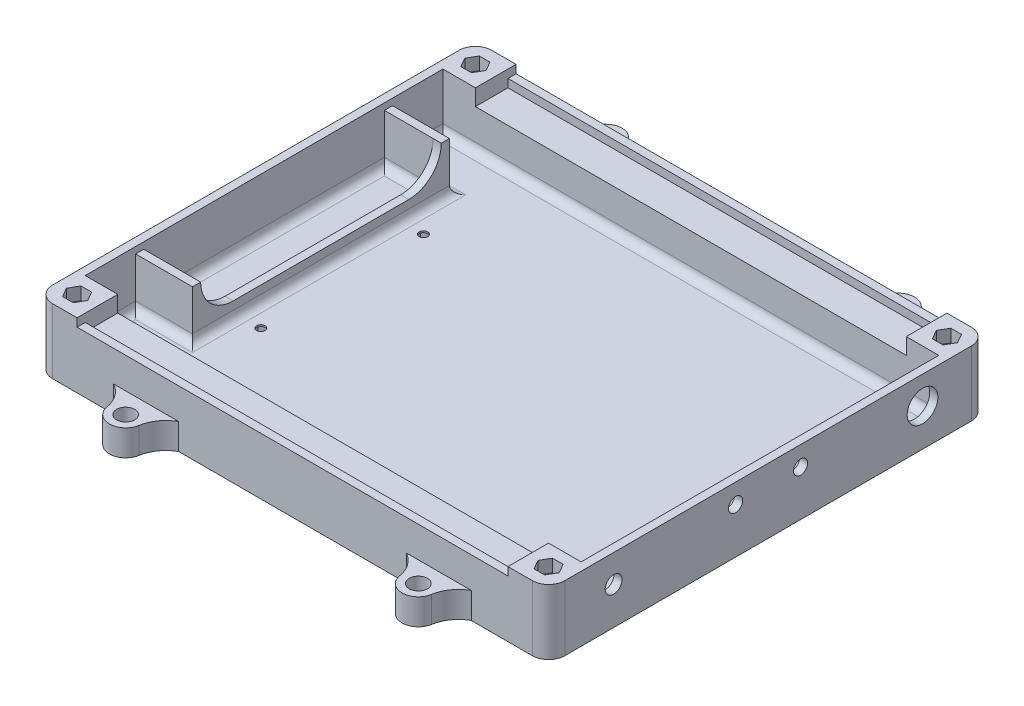
from build123d import *

# Parameters (mm, degrees)
SKETCH18_W              = 200.025
SKETCH18_H              = 139.7
BOSS_EXTRUDE6_DEPTH     = 25.4
SKETCH20_W              = 193.675
SKETCH20_H              = 139.7
CUT_EXTRUDE6_DEPTH      = 21.59
SKETCH22_W              = 200.025
SKETCH22_H              = 15.875
BOSS_EXTRUDE7_DEPTH     = 25.4
SKETCH23_W              = 200.025
SKETCH23_H              = 15.875
BOSS_EXTRUDE8_DEPTH     = 25.4
SKETCH24_W              = 168.275
SKETCH24_H              = 171.45
CUT_EXTRUDE7_DEPTH      = 3.175
SKETCH28_W              = 168.275
SKETCH28_H              = 12.7
CUT_EXTRUDE10_DEPTH     = 3.175
SKETCH31_R              = 1.65
SKETCH31_R_2            = 1.651
CUT_EXTRUDE15_DEPTH     = 1.825
CUT_EXTRUDE17_DEPTH     = 3.175
SKETCH39_R              = 2.2
CUT_EXTRUDE18_DEPTH     = 26.5
CUT_EXTRUDE20_DEPTH     = 5
SKETCH40_R              = 4.4
CUT_EXTRUDE19_DEPTH     = 17.225
SKETCH47_R              = 3.556
BOSS_EXTRUDE14_DEPTH    = 10.16
MIRROR6_COPY_1_SKETCH_R = 2.2
MIRROR6_COPY_1_DEPTH    = 26.5
MIRROR6_COPY_2_DEPTH    = 5
MIRROR6_COPY_3_SKETCH_R = 4.4
MIRROR6_COPY_3_DEPTH    = 17.225
CUT_EXTRUDE21_REACH     = 224.285
SKETCH48_R              = 6
SKETCH48_R_2            = 3.3
SKETCH48_R_3            = 2.75
SKETCH49_W              = 3.175
SKETCH49_H              = 93.98
BOSS_EXTRUDE15_DEPTH    = 6.35
SKETCH50_W              = 22.225
SKETCH50_H              = 3.175
BOSS_EXTRUDE16_DEPTH    = 19.05
FILLET1_R               = 6.35
FILLET2_R               = 3.175
FILLET3_R               = 12.7


with BuildPart() as part:
    # Sketch18 → Boss-Extrude6 (new body)
    with BuildSketch(Plane(origin=(0, 0, 0), x_dir=(1, 0, 0), z_dir=(0, 1, 0))):
        Rectangle(SKETCH18_W, SKETCH18_H)
    extrude(amount=BOSS_EXTRUDE6_DEPTH)

    # Sketch20 → Cut-Extrude6 (cut)
    with BuildSketch(Plane(origin=(0, 25.4, 0), x_dir=(1, 0, 0), z_dir=(0, 1, 0))):
        Rectangle(SKETCH20_W, SKETCH20_H)
    extrude(amount=-CUT_EXTRUDE6_DEPTH, mode=Mode.SUBTRACT)

    # Sketch22 → Boss-Extrude7 (add)
    with BuildSketch(Plane(origin=(0, 0, 0), x_dir=(1, 0, 0), z_dir=(0, 1, 0))):
        with Locations((0, -77.7875)):
            Rectangle(SKETCH22_W, SKETCH22_H)
    extrude(amount=BOSS_EXTRUDE7_DEPTH)

    # Sketch23 → Boss-Extrude8 (add)
    with BuildSketch(Plane(origin=(0, 0, 0), x_dir=(1, 0, 0), z_dir=(0, 1, 0))):
        with Locations((0, 77.7875)):
            Rectangle(SKETCH23_W, SKETCH23_H)
    extrude(amount=BOSS_EXTRUDE8_DEPTH)

    # Sketch24 → Cut-Extrude7 (cut)
    with BuildSketch(Plane(origin=(0, 25.4, 0), x_dir=(1, 0, 0), z_dir=(0, 1, 0))):
        Rectangle(SKETCH24_W, SKETCH24_H)
    extrude(amount=-CUT_EXTRUDE7_DEPTH, mode=Mode.SUBTRACT)

    # Sketch28 → Cut-Extrude10 (cut)
    with BuildSketch(Plane(origin=(0, 22.225, 0), x_dir=(1, 0, 0), z_dir=(0, 1, 0))):
        with Locations((0, 76.2)):
            Rectangle(SKETCH28_W, SKETCH28_H)
    cut_extrude10 = extrude(amount=-CUT_EXTRUDE10_DEPTH, mode=Mode.SUBTRACT)

    # Mirror5: Cut-Extrude10 across plane
    add(cut_extrude10.mirror(Plane.XY), mode=Mode.SUBTRACT)

    # Sketch31 → Cut-Extrude15 (cut)
    with BuildSketch(Plane(origin=(0, 3.81, 0), x_dir=(1, 0, 0), z_dir=(0, 1, 0))):
        with Locations(Location((-66.3575, 31.75, 0), (0, 0, 270))):
            Circle(SKETCH31_R)
        with Locations(Location((86.0425, 31.75, 0), (0, 0, 270))):
            Circle(SKETCH31_R_2)
        with Locations(Location((86.0425, -31.75, 0), (0, 0, 270))):
            Circle(SKETCH31_R_2)
        with Locations(Location((-66.3575, -31.75, 0), (0, 0, 270))):
            Circle(SKETCH31_R)
    extrude(amount=-CUT_EXTRUDE15_DEPTH, mode=Mode.SUBTRACT)

    # Sketch33 → Cut-Extrude17 (cut)
    with BuildSketch(Plane.XZ):
        Polygon((-63.5575, -33.366580754), (-63.5575, -30.133419246), (-66.3575, -28.516838493), (-69.1575, -30.133419246), (-69.1575, -33.366580754), (-66.3575, -34.983161507), align=None)
        Polygon((88.8425, -33.366580754), (88.8425, -30.133419246), (86.0425, -28.516838493), (83.2425, -30.133419246), (83.2425, -33.366580754), (86.0425, -34.983161507), align=None)
        Polygon((-63.5575, 33.366580754), (-66.3575, 34.983161507), (-69.1575, 33.366580754), (-69.1575, 30.133419246), (-66.3575, 28.516838493), (-63.5575, 30.133419246), align=None)
        Polygon((83.2425, 33.366580754), (83.2425, 30.133419246), (86.0425, 28.516838493), (88.8425, 30.133419246), (88.8425, 33.366580754), (86.0425, 34.983161507), align=None)
    extrude(amount=-CUT_EXTRUDE17_DEPTH, mode=Mode.SUBTRACT)

    # Sketch39 → Cut-Extrude18 (cut)
    with BuildSketch(Plane(origin=(0, 25.4, 0), x_dir=(1, 0, 0), z_dir=(0, 1, 0))):
        with Locations(Location((92.075, 77.7875, 0), (0, 0, 270))):
            Circle(SKETCH39_R)
    cut_extrude18 = extrude(amount=-CUT_EXTRUDE18_DEPTH, mode=Mode.SUBTRACT)

    # Sketch41 → Cut-Extrude20 (cut)
    with BuildSketch(Plane(origin=(0, 25.4, 0), x_dir=(1, 0, 0), z_dir=(0, 1, 0))):
        Polygon((89.996539031, 81.3875), (87.918078062, 77.7875), (89.996539031, 74.1875), (94.153460969, 74.1875), (96.231921938, 77.7875), (94.153460969, 81.3875), align=None)
    cut_extrude20 = extrude(amount=-CUT_EXTRUDE20_DEPTH, mode=Mode.SUBTRACT)

    # Sketch40 → Cut-Extrude19 (cut)
    with BuildSketch(Plane.XZ):
        with Locations(Location((92.075, -77.7875, 0), (0, 0, 270))):
            Circle(SKETCH40_R)
    cut_extrude19 = extrude(amount=-CUT_EXTRUDE19_DEPTH, mode=Mode.SUBTRACT)

    # Mirror3: Cut-Extrude18, Cut-Extrude20, Cut-Extrude19 across plane
    add(cut_extrude18.mirror(Plane.XY), mode=Mode.SUBTRACT)
    add(cut_extrude20.mirror(Plane.XY), mode=Mode.SUBTRACT)
    add(cut_extrude19.mirror(Plane.XY), mode=Mode.SUBTRACT)

    # Sketch47 → Boss-Extrude14 (add)
    # profile 1 of 2: a face of its own
    with BuildSketch(Plane.XZ):
        with BuildLine():
            Line((-44.45, -85.725), (-69.85, -85.725))
            ThreePointArc((-69.85, -85.725), (-65.589750808, -89.50934655), (-63.41304754, -94.775556275))
            ThreePointArc((-63.41304754, -94.775556275), (-61.253197141, -98.574568708), (-57.15, -100.078304866))
            ThreePointArc((-57.15, -100.078304866), (-53.046802859, -98.574568708), (-50.88695246, -94.775556275))
            ThreePointArc((-50.88695246, -94.775556275), (-48.710249192, -89.50934655), (-44.45, -85.725))
        make_face()
        with Locations(Location((-57.15, -93.728304866, 0), (0, 0, 270))):
            Circle(SKETCH47_R, mode=Mode.SUBTRACT)
    # profile 2 of 2: a face of its own
    with BuildSketch(Plane.XZ):
        with BuildLine():
            Line((69.85, -85.725), (44.45, -85.725))
            ThreePointArc((44.45, -85.725), (48.710249192, -89.50934655), (50.88695246, -94.775556275))
            ThreePointArc((50.88695246, -94.775556275), (53.046802859, -98.574568708), (57.15, -100.078304866))
            ThreePointArc((57.15, -100.078304866), (61.253197141, -98.574568708), (63.41304754, -94.775556275))
            ThreePointArc((63.41304754, -94.775556275), (65.589750808, -89.50934655), (69.85, -85.725))
        make_face()
        with Locations(Location((57.15, -93.728304866, 0), (0, 0, 270))):
            Circle(SKETCH47_R, mode=Mode.SUBTRACT)
    boss_extrude14 = extrude(amount=-BOSS_EXTRUDE14_DEPTH)

    # Mirror4: Boss-Extrude14 across plane
    add(boss_extrude14.mirror(Plane.XY))

    # Mirror6: Cut-Extrude18, Cut-Extrude20, Cut-Extrude19 across plane
    add(cut_extrude18.mirror(Plane(origin=(0, 0, 0), x_dir=(0, 0, 1), z_dir=(1, 0, 0))), mode=Mode.SUBTRACT)
    add(cut_extrude20.mirror(Plane(origin=(0, 0, 0), x_dir=(0, 0, 1), z_dir=(1, 0, 0))), mode=Mode.SUBTRACT)
    add(cut_extrude19.mirror(Plane(origin=(0, 0, 0), x_dir=(0, 0, 1), z_dir=(1, 0, 0))), mode=Mode.SUBTRACT)

    # Mirror6 copy 1 sketch → Mirror6 copy 1 (cut)
    with BuildSketch(Plane(origin=(0, 25.4, 0), x_dir=(-1, 0, 0), z_dir=(0, 1, 0))):
        with Locations(Location((92.075, 77.7875, 0), (0, 0, 270))):
            Circle(MIRROR6_COPY_1_SKETCH_R)
    extrude(amount=-MIRROR6_COPY_1_DEPTH, mode=Mode.SUBTRACT)

    # Mirror6 copy 2 sketch → Mirror6 copy 2 (cut)
    with BuildSketch(Plane(origin=(0, 25.4, 0), x_dir=(-1, 0, 0), z_dir=(0, 1, 0))):
        Polygon((89.996539031, 81.3875), (87.918078062, 77.7875), (89.996539031, 74.1875), (94.153460969, 74.1875), (96.231921938, 77.7875), (94.153460969, 81.3875), align=None)
    extrude(amount=-MIRROR6_COPY_2_DEPTH, mode=Mode.SUBTRACT)

    # Mirror6 copy 3 sketch → Mirror6 copy 3 (cut)
    with BuildSketch(Plane(origin=(0, 0, 0), x_dir=(-1, 0, 0), z_dir=(0, -1, 0))):
        with Locations(Location((92.075, -77.7875, 0), (0, 0, 270))):
            Circle(MIRROR6_COPY_3_SKETCH_R)
    extrude(amount=-MIRROR6_COPY_3_DEPTH, mode=Mode.SUBTRACT)

    # Sketch48 → Cut-Extrude21 (cut, up to next)
    with BuildSketch(Plane.ZY.offset(-96.8375), mode=Mode.PRIVATE) as cut_extrude21_sk1:
        with Locations((-60.325, 14.605)):
            Circle(SKETCH48_R)
    cut_extrude21_tool1 = extrude(cut_extrude21_sk1.sketch, amount=-CUT_EXTRUDE21_REACH, mode=Mode.PRIVATE) & part.part
    # Sketch48 → Cut-Extrude21 (cut, up to next)
    with BuildSketch(Plane.ZY.offset(-96.8375), mode=Mode.PRIVATE) as cut_extrude21_sk2:
        with Locations((60.325, 14.605)):
            Circle(SKETCH48_R_2)
    cut_extrude21_tool2 = extrude(cut_extrude21_sk2.sketch, amount=-CUT_EXTRUDE21_REACH, mode=Mode.PRIVATE) & part.part
    # Sketch48 → Cut-Extrude21 (cut, up to next)
    with BuildSketch(Plane.ZY.offset(-96.8375), mode=Mode.PRIVATE) as cut_extrude21_sk3:
        with Locations((-12.7, 17.78)):
            Circle(SKETCH48_R_3)
    cut_extrude21_tool3 = extrude(cut_extrude21_sk3.sketch, amount=-CUT_EXTRUDE21_REACH, mode=Mode.PRIVATE) & part.part
    # Sketch48 → Cut-Extrude21 (cut, up to next)
    with BuildSketch(Plane.ZY.offset(-96.8375), mode=Mode.PRIVATE) as cut_extrude21_sk4:
        with Locations((12.7, 17.78)):
            Circle(SKETCH48_R_3)
    cut_extrude21_tool4 = extrude(cut_extrude21_sk4.sketch, amount=-CUT_EXTRUDE21_REACH, mode=Mode.PRIVATE) & part.part
    add(cut_extrude21_tool1.solids().sort_by_distance((96.8375, 14.605, -60.325))[0], mode=Mode.SUBTRACT)
    add(cut_extrude21_tool2.solids().sort_by_distance((96.8375, 14.605, 60.325))[0], mode=Mode.SUBTRACT)
    add(cut_extrude21_tool3.solids().sort_by_distance((96.8375, 17.78, -12.7))[0], mode=Mode.SUBTRACT)
    add(cut_extrude21_tool4.solids().sort_by_distance((96.8375, 17.78, 12.7))[0], mode=Mode.SUBTRACT)

    # Sketch49 → Boss-Extrude15 (add)
    with BuildSketch(Plane(origin=(0, 3.81, 0), x_dir=(1, 0, 0), z_dir=(0, 1, 0))):
        with Locations((-76.2, 0)):
            Rectangle(SKETCH49_W, SKETCH49_H)
    extrude(amount=BOSS_EXTRUDE15_DEPTH)

    # Sketch50 → Boss-Extrude16 (add)
    with BuildSketch(Plane(origin=(0, 3.81, 0), x_dir=(1, 0, 0), z_dir=(0, 1, 0))):
        with Locations((-85.725, 48.5775)):
            Rectangle(SKETCH50_W, SKETCH50_H)
        with Locations((-85.725, -48.5775)):
            Rectangle(SKETCH50_W, SKETCH50_H)
    extrude(amount=BOSS_EXTRUDE16_DEPTH)

    # Fillet1
    fillet1_edges = [part.edges().sort_by_distance(p)[0] for p in [
        (100.0125, 12.7, 85.725),
        (-100.0125, 12.7, 85.725),
        (-100.0125, 12.7, -85.725),
        (100.0125, 12.7, -85.725),
    ]]
    fillet(fillet1_edges, radius=FILLET1_R)

    # Fillet2
    fillet2_edges = [part.edges().sort_by_distance(p)[0] for p in [
        (-96.8375, 3.81, -60.0075),
        (0, 3.81, -69.85),
        (0, 3.81, 69.85),
        (-74.6125, 3.81, 0),
        (-77.7875, 3.81, 0),
        (-96.8375, 3.81, 0),
        (-87.3125, 3.81, -46.99),
        (-85.725, 3.81, -50.165),
        (-96.8375, 3.81, 60.0075),
        (-87.3125, 3.81, 46.99),
        (-85.725, 3.81, 50.165),
    ]]
    fillet(fillet2_edges, radius=FILLET2_R)

    # Fillet3
    fillet3_edges = [part.edges().sort_by_distance(p)[0] for p in [
        (-76.2, 10.16, 46.99),
        (-76.2, 10.16, -46.99),
    ]]
    fillet(fillet3_edges, radius=FILLET3_R - 0.0001)  # a hair under: the kernel refuses the full size


solid = part.part
